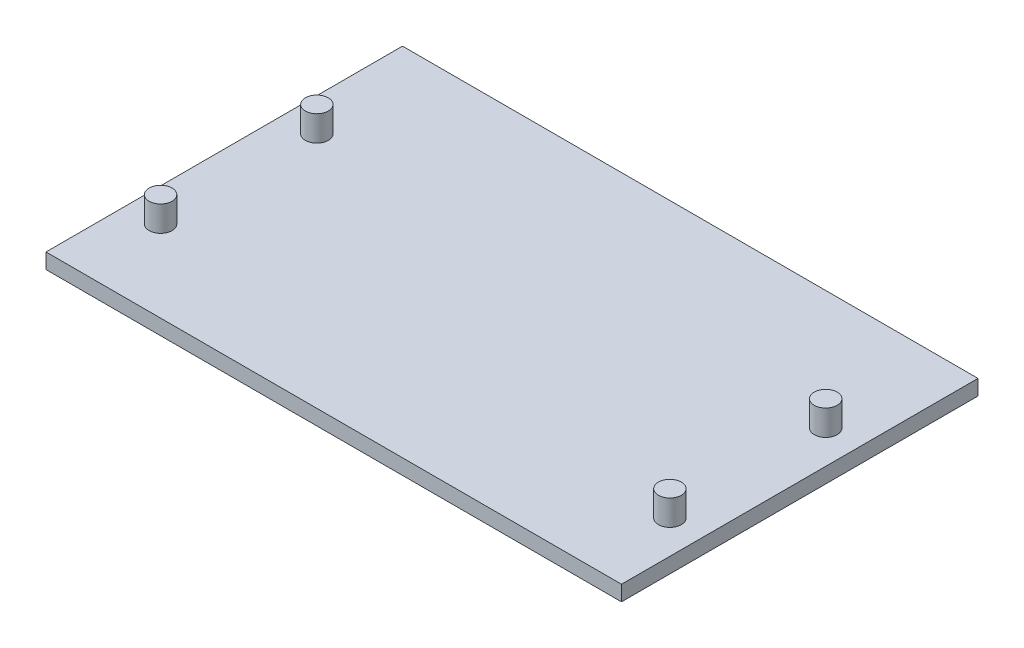
from build123d import *

# Parameters (mm, degrees)
SKETCH1_W           = 113
SKETCH1_H           = 70
BOSS_EXTRUDE1_DEPTH = 3
SKETCH2_R           = 2.25
BOSS_EXTRUDE2_DEPTH = 5


with BuildPart() as part:
    # Sketch1 → Boss-Extrude1 (new body)
    with BuildSketch(Plane(origin=(0, 0, 0), x_dir=(1, 0, 0), z_dir=(0, 1, 0))):
        with Locations((3.961254613, 5.029520295)):
            Rectangle(SKETCH1_W, SKETCH1_H)
    extrude(amount=BOSS_EXTRUDE1_DEPTH)

    # Sketch2 → Boss-Extrude2 (add)
    with BuildSketch(Plane(origin=(0, 3, 0), x_dir=(1, 0, 0), z_dir=(0, 1, 0))):
        with Locations((-46.038745387, 16.709520295)):
            Circle(SKETCH2_R)
        with Locations((53.961254613, 16.629520295)):
            Circle(SKETCH2_R)
        with Locations((53.961254613, -13.970479705)):
            Circle(SKETCH2_R)
        with Locations((-46.038745387, -13.970479705)):
            Circle(SKETCH2_R)
    extrude(amount=BOSS_EXTRUDE2_DEPTH)


solid = part.part
